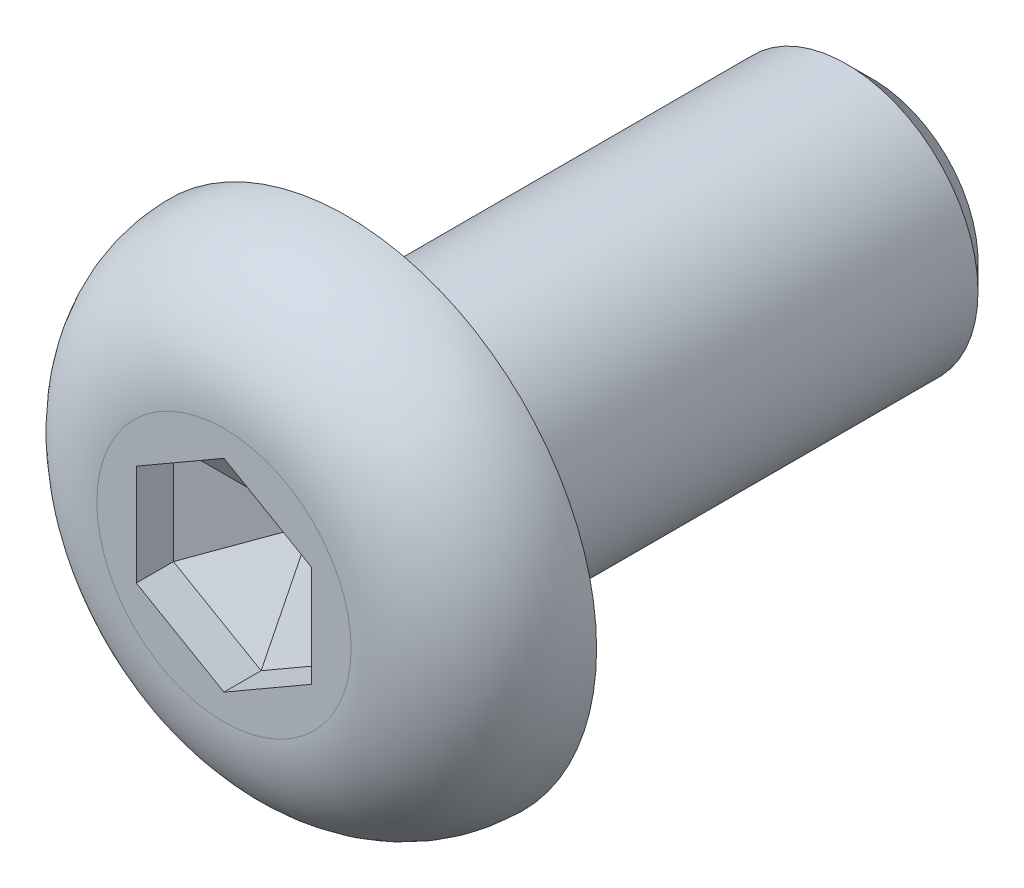
from build123d import *
from OCP.BRepFilletAPI import BRepFilletAPI_MakeChamfer

# Parameters (mm, degrees)
SKETCH_1_R          = 2.85
EXTRUDE_1_DEPTH     = 1.4
FILLET_1_R          = 1.4
SKETCH_3_R          = 1.5
EXTRUDE_3_DEPTH     = 6
CUT_EXTRUDE_1_DEPTH = 1
CHAMFER_2_SIZE      = 0.3
CHAMFER_3_SIZE      = 0.576368876
CHAMFER_3_SIZE2     = 0.998300177
FILLET_2_R          = 0.1


with BuildPart() as part:
    # 草图1 → 凸台-拉伸1 (new body)
    with BuildSketch(Plane.XY):
        Circle(SKETCH_1_R)
    extrude(amount=EXTRUDE_1_DEPTH)

    # 圆角1
    fillet_1_edges = [part.edges().sort_by_distance(p)[0] for p in [
        (-2.85, 0, 1.4),
    ]]
    fillet(fillet_1_edges, radius=FILLET_1_R - 0.0001)  # a hair under: the kernel refuses the full size

    # 草图3 → 凸台-拉伸3 (add)
    with BuildSketch(Plane(origin=(0, 0, 0), x_dir=(-1, 0, 0), z_dir=(0, 0, -1))):
        with Locations(Location((0, 0, 0), (0, 0, 180))):
            Circle(SKETCH_3_R)
    extrude(amount=EXTRUDE_3_DEPTH)

    # 草图4 → 切除-拉伸1 (cut)
    with BuildSketch(Plane.XY.offset(1.4)):
        Polygon((1, 0.577350269), (0, 1.154700538), (-1, 0.577350269), (-1, -0.577350269), (0, -1.154700538), (1, -0.577350269), align=None)
    extrude(amount=-CUT_EXTRUDE_1_DEPTH, mode=Mode.SUBTRACT)

    # 倒角2
    chamfer_2_edges = [part.edges().sort_by_distance(p)[0] for p in [
        (-1.5, 0, -6),
    ]]
    chamfer(chamfer_2_edges, length=CHAMFER_2_SIZE)

    # 倒角3: one chamfer whose edges measure the first distance from different faces: ONE call of the kernel's chamfer builder (chamfer() names one face for all edges)
    chamfer_3_edges_1 = [part.edges().sort_by_distance(p)[0] for p in [
        (1, 0, 0.4),
    ]]
    chamfer_3_side_1 = [part.faces().sort_by_distance(p)[0] for p in [
        (1, 0, 0.9),
    ]]
    chamfer_3_edges_2 = [part.edges().sort_by_distance(p)[0] for p in [
        (0.5, -0.866025404, 0.4),
    ]]
    chamfer_3_side_2 = [part.faces().sort_by_distance(p)[0] for p in [
        (0.5, -0.866025404, 0.9),
    ]]
    chamfer_3_edges_3 = [part.edges().sort_by_distance(p)[0] for p in [
        (-0.5, -0.866025404, 0.4),
    ]]
    chamfer_3_side_3 = [part.faces().sort_by_distance(p)[0] for p in [
        (-0.5, -0.866025404, 0.9),
    ]]
    chamfer_3_edges_4 = [part.edges().sort_by_distance(p)[0] for p in [
        (-1, 0, 0.4),
    ]]
    chamfer_3_side_4 = [part.faces().sort_by_distance(p)[0] for p in [
        (-1, 0, 0.9),
    ]]
    chamfer_3_edges_5 = [part.edges().sort_by_distance(p)[0] for p in [
        (-0.5, 0.866025404, 0.4),
    ]]
    chamfer_3_side_5 = [part.faces().sort_by_distance(p)[0] for p in [
        (-0.5, 0.866025404, 0.9),
    ]]
    chamfer_3_edges_6 = [part.edges().sort_by_distance(p)[0] for p in [
        (0.5, 0.866025404, 0.4),
    ]]
    chamfer_3_side_6 = [part.faces().sort_by_distance(p)[0] for p in [
        (0.5, 0.866025404, 0.9),
    ]]
    chamfer_3 = BRepFilletAPI_MakeChamfer(part.part.solid().wrapped)
    for e in chamfer_3_edges_1:
        chamfer_3.Add(CHAMFER_3_SIZE, CHAMFER_3_SIZE2, e.wrapped, chamfer_3_side_1[0].wrapped)  # the first distance lies on this face
    for e in chamfer_3_edges_2:
        chamfer_3.Add(CHAMFER_3_SIZE, CHAMFER_3_SIZE2, e.wrapped, chamfer_3_side_2[0].wrapped)  # the first distance lies on this face
    for e in chamfer_3_edges_3:
        chamfer_3.Add(CHAMFER_3_SIZE, CHAMFER_3_SIZE2, e.wrapped, chamfer_3_side_3[0].wrapped)  # the first distance lies on this face
    for e in chamfer_3_edges_4:
        chamfer_3.Add(CHAMFER_3_SIZE, CHAMFER_3_SIZE2, e.wrapped, chamfer_3_side_4[0].wrapped)  # the first distance lies on this face
    for e in chamfer_3_edges_5:
        chamfer_3.Add(CHAMFER_3_SIZE, CHAMFER_3_SIZE2, e.wrapped, chamfer_3_side_5[0].wrapped)  # the first distance lies on this face
    for e in chamfer_3_edges_6:
        chamfer_3.Add(CHAMFER_3_SIZE, CHAMFER_3_SIZE2, e.wrapped, chamfer_3_side_6[0].wrapped)  # the first distance lies on this face
    add(Compound.cast(chamfer_3.Shape()), mode=Mode.REPLACE)

    # 圆角2
    fillet_2_edges = [part.edges().sort_by_distance(p)[0] for p in [
        (-1.5, 0, 0),
    ]]
    fillet(fillet_2_edges, radius=FILLET_2_R)


solid = part.part
